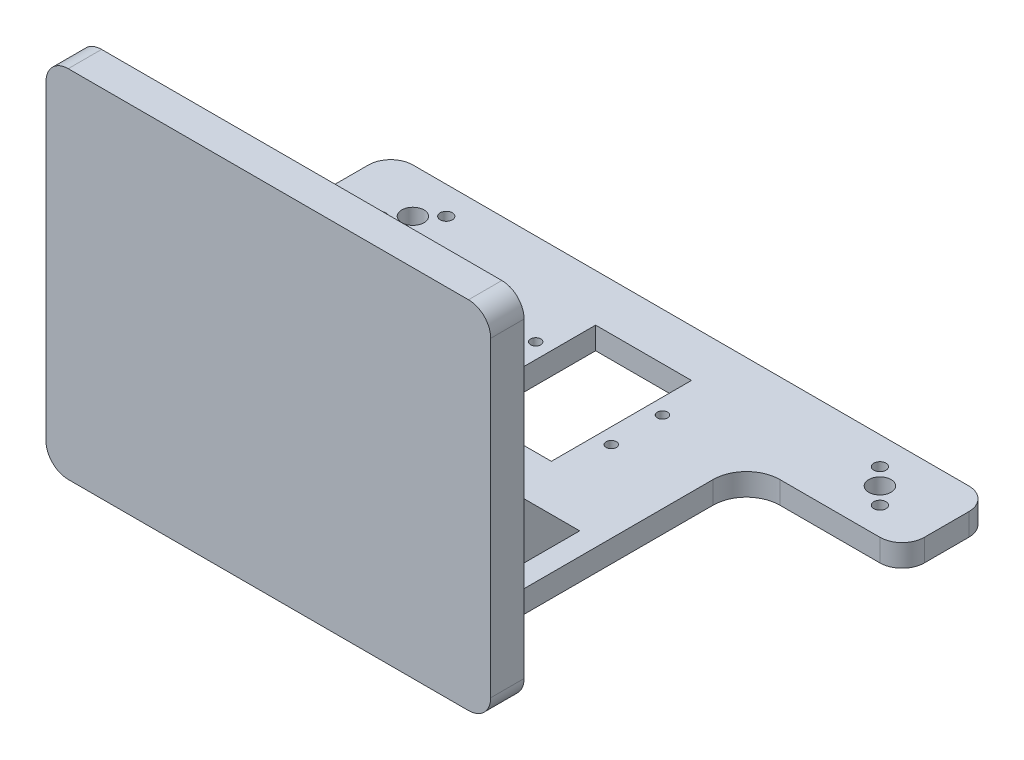
from build123d import *

# Parameters (mm, degrees)
SKIZZE1_R                       = 5
SKIZZE1_R_2                     = 2.75
SKIZZE1_R_3                     = 2.3
SKIZZE1_W                       = 43.1
SKIZZE1_H                       = 63
AUFSATZ_LINEAR_AUSTRAGEN1_DEPTH = 10
SKIZZE3_W                       = 200
SKIZZE3_H                       = 15
AUFSATZ_LINEAR_AUSTRAGEN2_DEPTH = 150
VERRUNDUNG1_R                   = 10
AUFSATZ_LINEAR_AUSTRAGEN3_DEPTH = 10
AUFSATZ_LINEAR_AUSTRAGEN4_DEPTH = 10


with BuildPart() as part:
    # Skizze1 → Aufsatz-Linear austragen1 (new body)
    with BuildSketch(Plane(origin=(0, 0, 0), x_dir=(1, 0, 0), z_dir=(0, 1, 0))):
        with BuildLine():
            Line((-125, 95), (125, 95))
            ThreePointArc((125, 95), (132.071067812, 92.071067812), (135, 85))
            Line((135, 85), (135, 65))
            ThreePointArc((135, 65), (132.071067812, 57.928932188), (125, 55))
            Line((125, 55), (80, 55))
            ThreePointArc((80, 55), (69.393398282, 50.606601718), (65, 40))
            Line((65, 40), (65, -65))
            ThreePointArc((65, -65), (69.393398282, -75.606601718), (80, -80))
            Line((80, -80), (90, -80))
            Line((90, -80), (100, -80))
            Line((100, -80), (100, -95))
            Line((100, -95), (80, -95))
            Line((80, -95), (-80, -95))
            Line((-80, -95), (-100, -95))
            Line((-100, -95), (-100, -80))
            Line((-100, -80), (-90, -80))
            Line((-90, -80), (-80, -80))
            ThreePointArc((-80, -80), (-69.393398282, -75.606601718), (-65, -65))
            Line((-65, -65), (-65, 40))
            ThreePointArc((-65, 40), (-69.393398282, 50.606601718), (-80, 55))
            Line((-80, 55), (-125, 55))
            ThreePointArc((-125, 55), (-132.071067812, 57.928932188), (-135, 65))
            Line((-135, 65), (-135, 85))
            ThreePointArc((-135, 85), (-132.071067812, 92.071067812), (-125, 95))
        make_face()
        with Locations((-105, 75)):
            Circle(SKIZZE1_R, mode=Mode.SUBTRACT)
        with Locations((105, 75)):
            Circle(SKIZZE1_R, mode=Mode.SUBTRACT)
        with Locations((-97.5, 82.5)):
            Circle(SKIZZE1_R_2, mode=Mode.SUBTRACT)
        with Locations((-112.5, 67.5)):
            Circle(SKIZZE1_R_2, mode=Mode.SUBTRACT)
        with Locations((97.5, 82.5)):
            Circle(SKIZZE1_R_2, mode=Mode.SUBTRACT)
        with Locations((112.5, 67.5)):
            Circle(SKIZZE1_R_2, mode=Mode.SUBTRACT)
        with Locations((-28.5, 53.71)):
            Circle(SKIZZE1_R_3, mode=Mode.SUBTRACT)
        with Locations((-28.5, 30.71)):
            Circle(SKIZZE1_R_3, mode=Mode.SUBTRACT)
        with Locations((28.5, 30.71)):
            Circle(SKIZZE1_R_3, mode=Mode.SUBTRACT)
        with Locations((28.5, 53.71)):
            Circle(SKIZZE1_R_3, mode=Mode.SUBTRACT)
        with Locations((0, 42.21)):
            Rectangle(SKIZZE1_W, SKIZZE1_H, mode=Mode.SUBTRACT)
    extrude(amount=AUFSATZ_LINEAR_AUSTRAGEN1_DEPTH)

    # Skizze3 → Aufsatz-Linear austragen2 (add)
    with BuildSketch(Plane(origin=(0, 10, 0), x_dir=(1, 0, 0), z_dir=(0, 1, 0))):
        with Locations((0, -87.5)):
            Rectangle(SKIZZE3_W, SKIZZE3_H)
    extrude(amount=AUFSATZ_LINEAR_AUSTRAGEN2_DEPTH)

    # Verrundung1
    verrundung1_edges = [part.edges().sort_by_distance(p)[0] for p in [
        (100, 0, 87.5),
        (-100, 0, 87.5),
        (-100, 160, 87.5),
        (100, 160, 87.5),
    ]]
    fillet(verrundung1_edges, radius=VERRUNDUNG1_R)

    # Skizze5 → Aufsatz-Linear austragen3 (add)
    with BuildSketch(Plane.ZY.offset(50)):
        Polygon((10, 10), (80, 80), (80, 10), align=None)
    extrude(amount=-AUFSATZ_LINEAR_AUSTRAGEN3_DEPTH)

    # Skizze6 → Aufsatz-Linear austragen4 (add)
    with BuildSketch(Plane(origin=(55, 0, 0), x_dir=(0, 0, -1), z_dir=(1, 0, 0))):
        Polygon((-10, 10), (-80, 80), (-80, 10), align=None)
    extrude(amount=-AUFSATZ_LINEAR_AUSTRAGEN4_DEPTH)


solid = part.part
